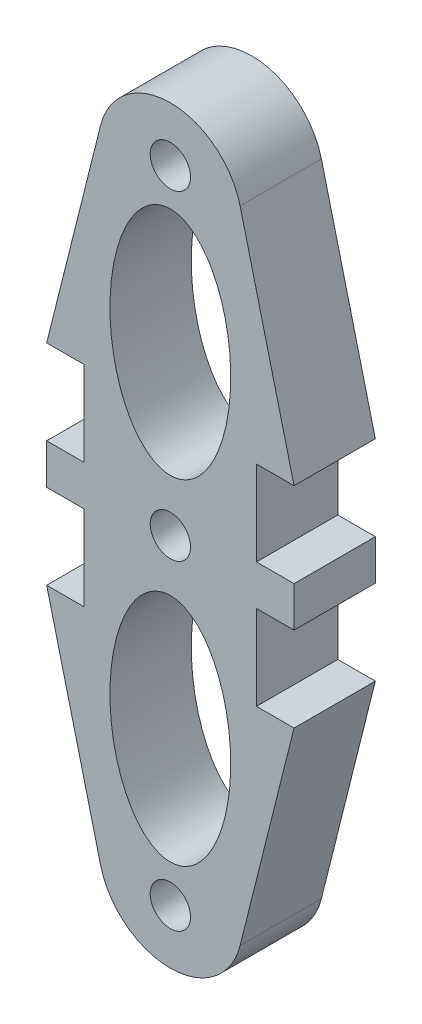
from build123d import *

# Parameters (mm, degrees)
SKETCH1_R           = 1.45
BOSS_EXTRUDE1_DEPTH = 5.85


with BuildPart() as part:
    # Sketch1 → Boss-Extrude1 (new body)
    with BuildSketch(Plane.XY):
        with BuildLine():
            Line((781.459168709, 470.952359197), (781.459168709, 464.852359197))
            Line((781.459168709, 464.852359197), (778.759168709, 464.852359197))
            Line((778.759168709, 464.852359197), (778.759168709, 461.952359197))
            Line((778.759168709, 461.952359197), (781.459168709, 461.952359197))
            Line((781.459168709, 461.952359197), (781.459168709, 455.852359197))
            Line((781.459168709, 455.852359197), (778.759168709, 455.852359197))
            Line((778.759168709, 455.852359197), (782.640133233, 440.352359197))
            ThreePointArc((782.640133233, 440.352359197), (787.659168709, 436.435077315), (792.678204185, 440.352359197))
            Line((792.678204185, 440.352359197), (796.559168709, 455.852359197))
            Line((796.559168709, 455.852359197), (793.859168709, 455.852359197))
            Line((793.859168709, 455.852359197), (793.859168709, 461.952359197))
            Line((793.859168709, 461.952359197), (796.559168709, 461.952359197))
            Line((796.559168709, 461.952359197), (796.559168709, 464.852359197))
            Line((796.559168709, 464.852359197), (793.859168709, 464.852359197))
            Line((793.859168709, 464.852359197), (793.859168709, 470.952359197))
            Line((793.859168709, 470.952359197), (796.559168709, 470.952359197))
            Line((796.559168709, 470.952359197), (792.678204185, 486.452359197))
            ThreePointArc((792.678204185, 486.452359197), (787.659168709, 490.369641078), (782.640133233, 486.452359197))
            Line((782.640133233, 486.452359197), (778.759168709, 470.952359197))
            Line((778.759168709, 470.952359197), (781.459168709, 470.952359197))
        make_face()
        with BuildLine():
            add(Edge.make_bspline(
                [(787.659168709, 443.054519601), (795.187523069, 443.054519601), (791.423345889, 455.507640433), (787.659168709, 467.960761265), (783.894991529, 455.507640433), (780.130814348, 443.054519601), (787.659168709, 443.054519601)],
                knots=[0, 0, 0, 2.094395102, 2.094395102, 4.188790205, 4.188790205, 6.283185307, 6.283185307, 6.283185307], degree=2, weights=[1, 0.5, 1, 0.5, 1, 0.5, 1]))
        make_face(mode=Mode.SUBTRACT)
        with Locations((787.659168709, 440.352359197)):
            Circle(SKETCH1_R, mode=Mode.SUBTRACT)
        with Locations((787.659168709, 463.402359197)):
            Circle(SKETCH1_R, mode=Mode.SUBTRACT)
        with BuildLine():
            add(Edge.make_bspline(
                [(787.659168709, 483.750198792), (780.130814348, 483.750198792), (783.894991529, 471.29707796), (787.659168709, 458.843957128), (791.423345889, 471.29707796), (795.187523069, 483.750198792), (787.659168709, 483.750198792)],
                knots=[0, 0, 0, 2.094395102, 2.094395102, 4.188790205, 4.188790205, 6.283185307, 6.283185307, 6.283185307], degree=2, weights=[1, 0.5, 1, 0.5, 1, 0.5, 1]))
        make_face(mode=Mode.SUBTRACT)
        with Locations((787.659168709, 486.452359197)):
            Circle(SKETCH1_R, mode=Mode.SUBTRACT)
    extrude(amount=BOSS_EXTRUDE1_DEPTH)


solid = part.part
